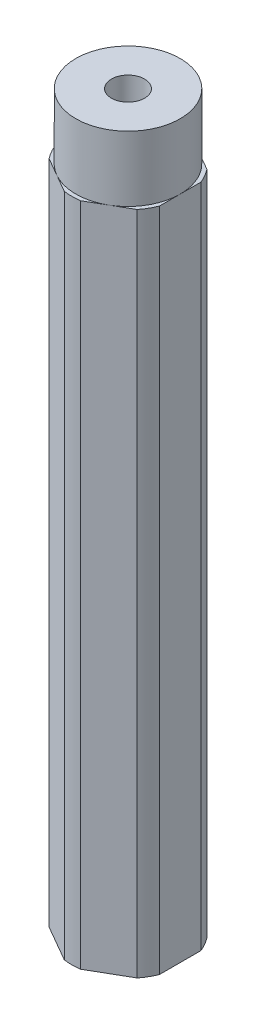
from build123d import *

# Parameters (mm, degrees)
BOSS_EXTRUDE1_DEPTH        = 40.48125
SKETCH3_R                  = 6.35
BOSS_EXTRUDE2_DEPTH        = 7.9375
F_10_32_TAPPED_HOLE1_D     = 4.0386
F_10_32_TAPPED_HOLE1_DEPTH = 12.02944
F_10_32_TAPPED_HOLE1_TIP   = 1.213317848
SKETCH2_R                  = 2.0193
CUT_EXTRUDE1_DEPTH         = 90.388013306


with BuildPart() as part:
    # Sketch1 → Boss-Extrude1 (new, symmetric)
    with BuildSketch(Plane(origin=(0, 0, 0), x_dir=(1, 0, 0), z_dir=(0, 1, 0))):
        with BuildLine():
            ThreePointArc((0.990636919, 6.760403927), (0, 6.8326), (-0.990636919, 6.760403927))
            Line((-0.990636919, 6.760403927), (-5.359363081, 4.238118701))
            ThreePointArc((-5.359363081, 4.238118701), (-5.917205174, 3.4163), (-6.35, 2.522285226))
            Line((-6.35, 2.522285226), (-6.35, -2.522285226))
            ThreePointArc((-6.35, -2.522285226), (-5.917205174, -3.4163), (-5.359363081, -4.238118701))
            Line((-5.359363081, -4.238118701), (-0.990636919, -6.760403927))
            ThreePointArc((-0.990636919, -6.760403927), (0, -6.8326), (0.990636919, -6.760403927))
            Line((0.990636919, -6.760403927), (5.359363081, -4.238118701))
            ThreePointArc((5.359363081, -4.238118701), (5.917205174, -3.4163), (6.35, -2.522285226))
            Line((6.35, -2.522285226), (6.35, 2.522285226))
            ThreePointArc((6.35, 2.522285226), (5.917205174, 3.4163), (5.359363081, 4.238118701))
            Line((5.359363081, 4.238118701), (0.990636919, 6.760403927))
        make_face()
    extrude(amount=BOSS_EXTRUDE1_DEPTH, both=True)

    # Sketch3 → Boss-Extrude2 (add)
    with BuildSketch(Plane(origin=(0, 40.48125, 0), x_dir=(1, 0, 0), z_dir=(0, 1, 0))):
        Circle(SKETCH3_R)
    extrude(amount=BOSS_EXTRUDE2_DEPTH)

    # #10-32 Tapped Hole1
    with Locations(Plane(origin=(0, -40.48125, 0), x_dir=(-1, 0, 0), z_dir=(0, -1, 0))):
        with Locations((0, 0)):
            Hole(F_10_32_TAPPED_HOLE1_D / 2, depth=F_10_32_TAPPED_HOLE1_DEPTH)
            with Locations((0, 0, -(F_10_32_TAPPED_HOLE1_DEPTH + F_10_32_TAPPED_HOLE1_TIP / 2))):  # 118° drill point
                Cone(0, F_10_32_TAPPED_HOLE1_D / 2, F_10_32_TAPPED_HOLE1_TIP, mode=Mode.SUBTRACT)

    # Sketch2 → Cut-Extrude1 (cut, through all)
    with BuildSketch(Plane(origin=(0, -40.48125, 0), x_dir=(1, 0, 0), z_dir=(0, 1, 0))):
        Circle(SKETCH2_R)
    extrude(amount=CUT_EXTRUDE1_DEPTH, mode=Mode.SUBTRACT)


solid = part.part
